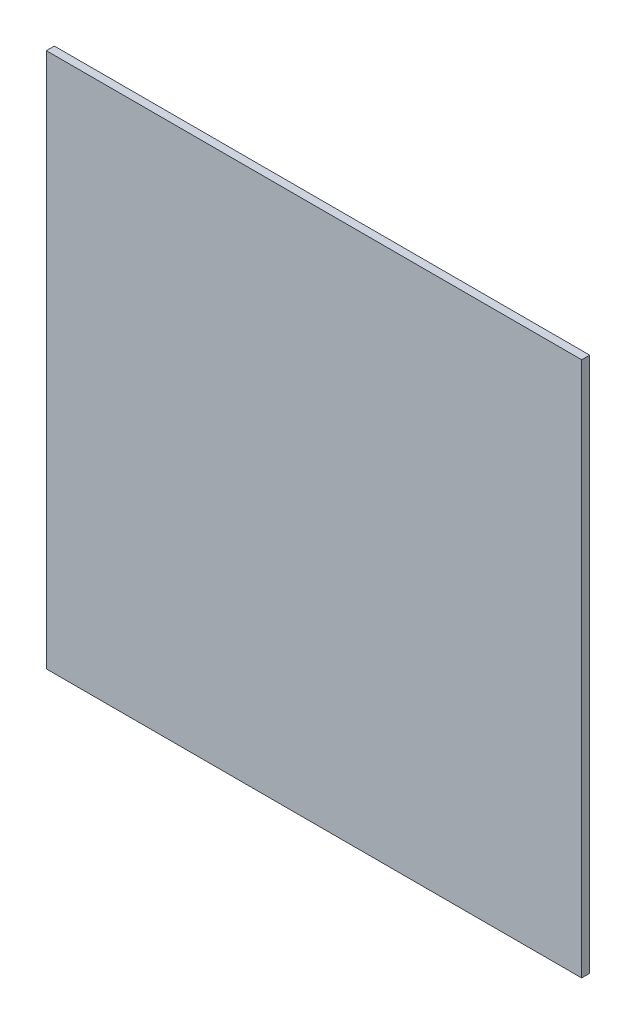
from build123d import *

# Parameters (mm, degrees)
SKETCH1_W           = 1219.2
SKETCH1_H           = 1219.2
BOSS_EXTRUDE1_DEPTH = 18.25625


with BuildPart() as part:
    # Sketch1 → Boss-Extrude1 (new body)
    with BuildSketch(Plane.XY):
        with Locations((62.55026087, -244.900173913)):
            Rectangle(SKETCH1_W, SKETCH1_H)
    extrude(amount=BOSS_EXTRUDE1_DEPTH)


solid = part.part
